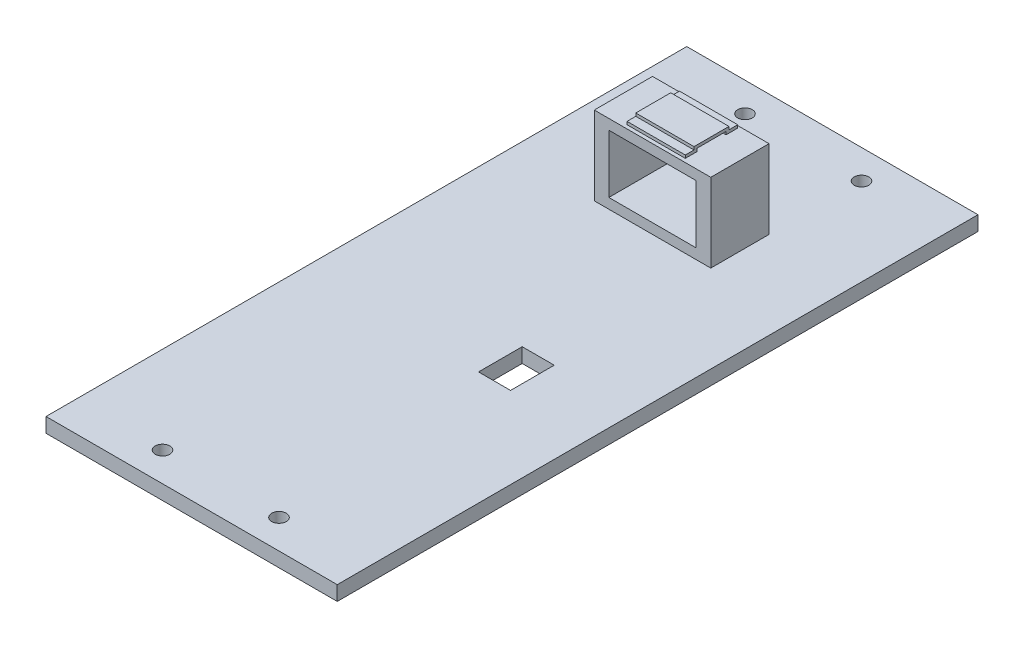
from build123d import *

# Parameters (mm, degrees)
SKETCH_1_W                 = 100
SKETCH_1_H                 = 220
EXTRUDE_1_DEPTH            = 5
CUT_EXTRUDE_1_REACH        = 122.934
SKETCH_2_R                 = 2.5
CUT_EXTRUDE_2_REACH        = 122.934
SKETCH_3_W                 = 11
SKETCH_3_H                 = 15
SKETCH_5_W                 = 20
SKETCH_5_H                 = 27
EXTRUDE_2_DEPTH            = 20
EXTRUDE_START              = -10
EXTRUDE_1_2_DEPTH          = 20
CUT_EXTRUDE_3_REACH        = 190.226
SKETCH_7_W                 = 30
SKETCH_7_H                 = 20
SPLIT_START                = 5
SPLIT_BODIES_2_OUTLINE_W   = 40
SPLIT_BODIES_2_OUTLINE_H   = 20
SPLIT_BODIES_2_DEPTH       = 29
SPLIT_BODIES_2_2_OUTLINE_W = 5
SPLIT_BODIES_2_2_OUTLINE_H = 20
SPLIT_BODIES_2_2_DEPTH     = 27
SPLIT_BODIES_2_3_OUTLINE_W = 30
SPLIT_BODIES_2_3_OUTLINE_H = 20
SPLIT_BODIES_2_3_DEPTH     = 3.5
SPLIT_START_2              = 28.5
SPLIT_BODIES_2_4_OUTLINE_W = 30
SPLIT_BODIES_2_4_OUTLINE_H = 20
SPLIT_BODIES_2_4_DEPTH     = 3.5
SPLIT_START_3              = 33
SPLIT_BODIES_2_5_OUTLINE_W = 20
SPLIT_BODIES_2_5_OUTLINE_H = 12
SPLIT_BODIES_2_5_DEPTH     = 1
SPLIT_START_4              = 32
SPLIT_BODIES_2_6_OUTLINE_W = 20
SPLIT_BODIES_2_6_OUTLINE_H = 4
SPLIT_BODIES_2_6_DEPTH     = 1


# Read off the part's stored shape, not the designer's step: 拉伸-薄壁1, 分割2
with BuildPart() as part:
    # 草图1 → Extrude 1 (new body)
    with BuildSketch(Plane(origin=(0, 0, 0), x_dir=(1, 0, 0), z_dir=(0, 1, 0))):
        Rectangle(SKETCH_1_W, SKETCH_1_H)
    extrude(amount=EXTRUDE_1_DEPTH)

    # 草图2 → 切除-拉伸1 (cut, up to next)
    with BuildSketch(Plane(origin=(0, 5, 0), x_dir=(1, 0, 0), z_dir=(0, 1, 0)), mode=Mode.PRIVATE) as cut_extrude_1_sk1:
        with Locations(Location((-20, 100, 0), (0, 0, 270))):
            Circle(SKETCH_2_R)
    cut_extrude_1_tool1 = extrude(cut_extrude_1_sk1.sketch, amount=-CUT_EXTRUDE_1_REACH, mode=Mode.PRIVATE) & part.part
    # 草图2 → 切除-拉伸1 (cut, up to next)
    with BuildSketch(Plane(origin=(0, 5, 0), x_dir=(1, 0, 0), z_dir=(0, 1, 0)), mode=Mode.PRIVATE) as cut_extrude_1_sk2:
        with Locations(Location((-20, -100, 0), (0, 0, 270))):
            Circle(SKETCH_2_R)
    cut_extrude_1_tool2 = extrude(cut_extrude_1_sk2.sketch, amount=-CUT_EXTRUDE_1_REACH, mode=Mode.PRIVATE) & part.part
    # 草图2 → 切除-拉伸1 (cut, up to next)
    with BuildSketch(Plane(origin=(0, 5, 0), x_dir=(1, 0, 0), z_dir=(0, 1, 0)), mode=Mode.PRIVATE) as cut_extrude_1_sk3:
        with Locations(Location((20, 100, 0), (0, 0, 270))):
            Circle(SKETCH_2_R)
    cut_extrude_1_tool3 = extrude(cut_extrude_1_sk3.sketch, amount=-CUT_EXTRUDE_1_REACH, mode=Mode.PRIVATE) & part.part
    # 草图2 → 切除-拉伸1 (cut, up to next)
    with BuildSketch(Plane(origin=(0, 5, 0), x_dir=(1, 0, 0), z_dir=(0, 1, 0)), mode=Mode.PRIVATE) as cut_extrude_1_sk4:
        with Locations(Location((20, -100, 0), (0, 0, 270))):
            Circle(SKETCH_2_R)
    cut_extrude_1_tool4 = extrude(cut_extrude_1_sk4.sketch, amount=-CUT_EXTRUDE_1_REACH, mode=Mode.PRIVATE) & part.part
    add(cut_extrude_1_tool1.solids().sort_by_distance((-20, 5, -100))[0], mode=Mode.SUBTRACT)
    add(cut_extrude_1_tool2.solids().sort_by_distance((-20, 5, 100))[0], mode=Mode.SUBTRACT)
    add(cut_extrude_1_tool3.solids().sort_by_distance((20, 5, -100))[0], mode=Mode.SUBTRACT)
    add(cut_extrude_1_tool4.solids().sort_by_distance((20, 5, 100))[0], mode=Mode.SUBTRACT)

    # 草图3 → 切除-拉伸2 (cut, up to next)
    with BuildSketch(Plane(origin=(0, 5, 0), x_dir=(1, 0, 0), z_dir=(0, 1, 0)), mode=Mode.PRIVATE) as cut_extrude_2_sk1:
        with Locations((16.5, -15)):
            Rectangle(SKETCH_3_W, SKETCH_3_H)
    cut_extrude_2_tool1 = extrude(cut_extrude_2_sk1.sketch, amount=-CUT_EXTRUDE_2_REACH, mode=Mode.PRIVATE) & part.part
    add(cut_extrude_2_tool1.solids().sort_by_distance((16.5, 5, 15))[0], mode=Mode.SUBTRACT)

    # 草图5 → 凸台-拉伸2 (add, symmetric)
    with BuildSketch(Plane(origin=(0, 0, 0), x_dir=(0, 0, -1), z_dir=(1, 0, 0))):
        with Locations((58.25, 18.5)):
            Rectangle(SKETCH_5_W, SKETCH_5_H)
    extrude(amount=EXTRUDE_2_DEPTH, both=True)

    # Extrude 1 2 outline → Extrude 1 2 (add)
    with BuildSketch(Plane(origin=(0, 0, 0), x_dir=(0, 0, -1), z_dir=(1, 0, 0)).offset(EXTRUDE_START)):
        Polygon((49.5, 33), (49.5, 32), (53.5, 32), (53.5, 33), (63.5, 33), (63.5, 32), (67.5, 32), (67.5, 33), (64.5, 33), (64.5, 34), (52.5, 34), (52.5, 33), align=None)
    extrude(amount=EXTRUDE_1_2_DEPTH)

    # 草图7 → 切除-拉伸3 (cut, up to next)
    with BuildSketch(Plane(origin=(0, 0, -68.25), x_dir=(-1, 0, 0), z_dir=(0, 0, -1)), mode=Mode.PRIVATE) as cut_extrude_3_sk1:
        with Locations((0, 18.5)):
            Rectangle(SKETCH_7_W, SKETCH_7_H)
    cut_extrude_3_tool1 = extrude(cut_extrude_3_sk1.sketch, amount=-CUT_EXTRUDE_3_REACH, mode=Mode.PRIVATE) & part.part
    add(cut_extrude_3_tool1.solids().sort_by_distance((0, 18.5, -68.25))[0], mode=Mode.SUBTRACT)

    # Split Bodies 2 outline → Split Bodies 2 (cut)
    with BuildSketch(Plane(origin=(0, 0, 0), x_dir=(1, 0, 0), z_dir=(0, 1, 0)).offset(SPLIT_START)):
        with Locations((0, 58.25)):
            Rectangle(SPLIT_BODIES_2_OUTLINE_W, SPLIT_BODIES_2_OUTLINE_H)
    extrude(amount=SPLIT_BODIES_2_DEPTH, mode=Mode.SUBTRACT)


with BuildPart() as body_2:
    # Split Bodies 2 2 outline → Split Bodies 2 2 (new body)
    with BuildSketch(Plane(origin=(0, 0, 0), x_dir=(1, 0, 0), z_dir=(0, 1, 0)).offset(SPLIT_START)):
        with Locations((17.5, 58.25)):
            Rectangle(SPLIT_BODIES_2_2_OUTLINE_W, SPLIT_BODIES_2_2_OUTLINE_H)
        with Locations((-17.5, 58.25)):
            Rectangle(SPLIT_BODIES_2_2_OUTLINE_W, SPLIT_BODIES_2_2_OUTLINE_H)
    extrude(amount=SPLIT_BODIES_2_2_DEPTH)

    # Split Bodies 2 3 outline → Split Bodies 2 3 (add)
    with BuildSketch(Plane(origin=(0, 0, 0), x_dir=(1, 0, 0), z_dir=(0, 1, 0)).offset(SPLIT_START)):
        with Locations((0, 58.25)):
            Rectangle(SPLIT_BODIES_2_3_OUTLINE_W, SPLIT_BODIES_2_3_OUTLINE_H)
    extrude(amount=SPLIT_BODIES_2_3_DEPTH)

    # Split Bodies 2 4 outline → Split Bodies 2 4 (add)
    with BuildSketch(Plane(origin=(0, 0, 0), x_dir=(1, 0, 0), z_dir=(0, 1, 0)).offset(SPLIT_START_2)):
        with Locations((0, 58.25)):
            Rectangle(SPLIT_BODIES_2_4_OUTLINE_W, SPLIT_BODIES_2_4_OUTLINE_H)
    extrude(amount=SPLIT_BODIES_2_4_DEPTH)

    # Split Bodies 2 5 outline → Split Bodies 2 5 (add)
    with BuildSketch(Plane(origin=(0, 0, 0), x_dir=(1, 0, 0), z_dir=(0, 1, 0)).offset(SPLIT_START_3)):
        with Locations((0, 58.5)):
            Rectangle(SPLIT_BODIES_2_5_OUTLINE_W, SPLIT_BODIES_2_5_OUTLINE_H)
    extrude(amount=SPLIT_BODIES_2_5_DEPTH)

    # Split Bodies 2 6 outline → Split Bodies 2 6 (add)
    with BuildSketch(Plane(origin=(0, 0, 0), x_dir=(1, 0, 0), z_dir=(0, 1, 0)).offset(SPLIT_START_4)):
        with Locations((0, 51.5)):
            Rectangle(SPLIT_BODIES_2_6_OUTLINE_W, SPLIT_BODIES_2_6_OUTLINE_H)
        with Locations((0, 65.5)):
            Rectangle(SPLIT_BODIES_2_6_OUTLINE_W, SPLIT_BODIES_2_6_OUTLINE_H)
    extrude(amount=SPLIT_BODIES_2_6_DEPTH)


solid = Compound([part.part, body_2.part])
